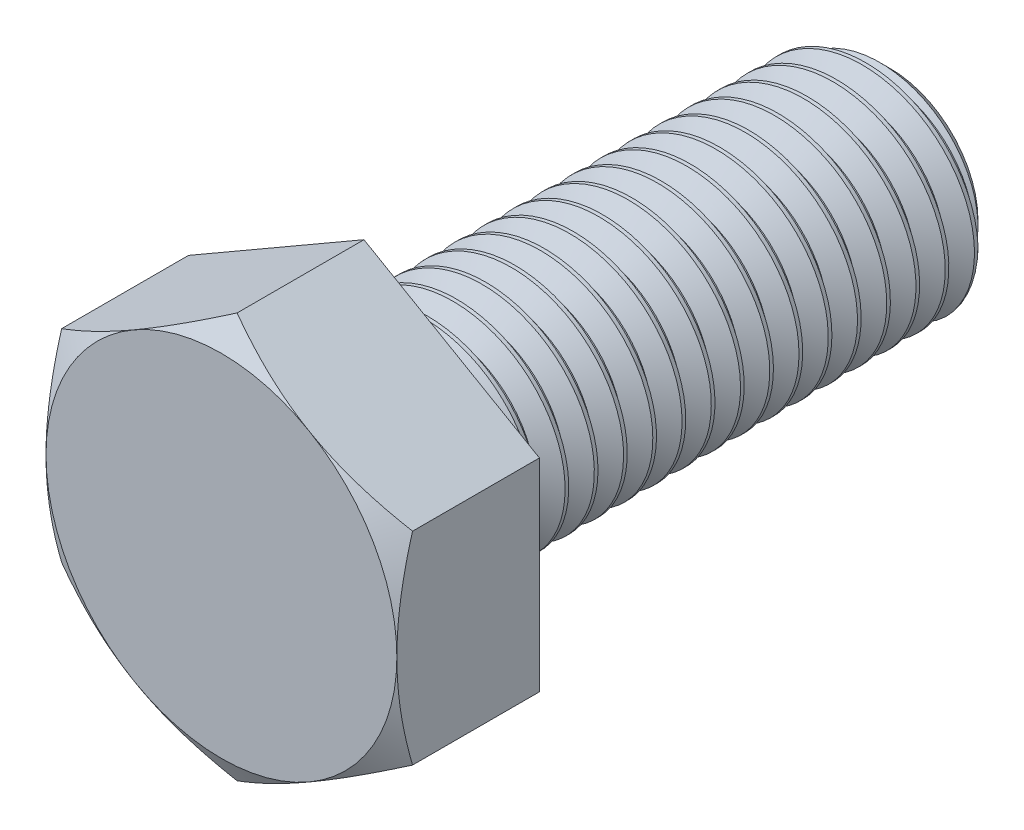
from build123d import *

# Parameters (mm, degrees)
SKETCH2_W           = 19.05
SKETCH2_H           = 3.96875
BOSS_EXTRUDE1_DEPTH = 5.159375
CHAMFER1_SIZE       = 0.79375
SKETCH4_OUTSIDE_W   = 114.714
SKETCH4_OUTSIDE_H   = 116.678
SKETCH4_OUTSIDE_R   = 6.35
CUT_EXTRUDE1_DEPTH  = 27.080254432
CUT_EXTRUDE1_DRAFT  = -60
CUT_SWEEP1_PITCH    = 1.058333333
CUT_SWEEP1_TO       = 19.05


with BuildPart() as part:
    # Sketch2 → Revolve1 (revolve)
    with BuildSketch(Plane(origin=(0, 0, 0), x_dir=(0, 0, -1), z_dir=(1, 0, 0)), mode=Mode.PRIVATE) as revolve1_sk:
        with Locations((9.525, 1.984375)):
            Rectangle(SKETCH2_W, SKETCH2_H)
    revolve(revolve1_sk.sketch.rotate(Axis((0, 0, 0), (0, 0, -1)), 90), axis=Axis((0, 0, 0), (0, 0, -1)))

    # Sketch3 → Boss-Extrude1 (add)
    with BuildSketch(Plane.XY):
        Polygon((0, 7.332348419), (-6.35, 3.666174209), (-6.35, -3.666174209), (0, -7.332348419), (6.35, -3.666174209), (6.35, 3.666174209), align=None)
    extrude(amount=BOSS_EXTRUDE1_DEPTH)

    # Chamfer1
    chamfer1_edges = [part.edges().sort_by_distance(p)[0] for p in [
        (-3.96875, 0, -19.05),
    ]]
    chamfer(chamfer1_edges, length=CHAMFER1_SIZE)


with BuildPart() as cut_extrude1_tool:
    # Sketch4 outside → Cut-Extrude1 (with draft: the straight prism first)
    with BuildSketch(Plane.XY.offset(5.159375)):
        Rectangle(SKETCH4_OUTSIDE_W, SKETCH4_OUTSIDE_H)
        Circle(SKETCH4_OUTSIDE_R, mode=Mode.SUBTRACT)
    extrude(amount=-CUT_EXTRUDE1_DEPTH)
    # Cut-Extrude1: the draft: its side faces are tilted about the plane it starts from
    cut_extrude1_sides = [cut_extrude1_tool.faces().sort_by_distance(p)[0] for p in [
        (0, -58.339, -8.380752216),
        (57.357, 0, -8.380752216),
        (0, 58.339, -8.380752216),
        (-57.357, 0, -8.380752216),
        (-6.35, 0, -8.380752216),
    ]]
    draft(cut_extrude1_sides, Plane.XY.offset(5.159375), CUT_EXTRUDE1_DRAFT)


with BuildPart() as part_1:
    add(part.part)

    # Cut-Extrude1: cut by cut_extrude1_tool
    add(cut_extrude1_tool.part, mode=Mode.SUBTRACT)


with BuildPart() as body_2:
    # Split1: read off the stored shape, not the designer's step
    # Split1: the piece on the far side of the plane
    add(part_1.part)
    split(bisect_by=Plane.XY, keep=Keep.BOTTOM)

    # Cut-Sweep1: arcs per turn and ends read off the stored shape
    # Cut-Sweep1: the profile of Sketch5 screwed along a right-hand helix through 19 turns, 8 arcs to a turn; built about Z, then put on its axis
    cut_sweep1_z = Axis((0, 0, 0), (0, 0, 1))
    cut_sweep1_corners = [(4.026033972, 0, 0.033072917), (4.026033972, 0, -0.959114583), (3.281342336, 0, -0.529166667), (3.281342336, 0, -0.396875)]
    with BuildLine(mode=Mode.PRIVATE) as cut_sweep1_profile:
        Line(cut_sweep1_corners[0], cut_sweep1_corners[1])
        Line(cut_sweep1_corners[1], cut_sweep1_corners[2])
        Line(cut_sweep1_corners[2], cut_sweep1_corners[3])
        Line(cut_sweep1_corners[3], cut_sweep1_corners[0])
    cut_sweep1_cap = Face(cut_sweep1_profile.wire())
    cut_sweep1_turn_angles = [0, 22.5, 45, 67.5, 90, 112.5, 135, 157.5, 180, 202.5, 225, 247.5, 270, 292.5, 315, 337.5, 360]
    cut_sweep1_turn_weights = [1, 0.9238795325112867, 1, 0.9238795325112867, 1, 0.9238795325112867, 1, 0.9238795325112867, 1, 0.9238795325112867, 1, 0.9238795325112867, 1, 0.9238795325112867, 1, 0.9238795325112867, 1]
    cut_sweep1_turn_rails = [Edge.make_bspline([Vector(p[0], p[1], 0).rotate(cut_sweep1_z, cut_sweep1_turn_angles[k]) / cut_sweep1_turn_weights[k] + Vector(0, 0, p[2] + CUT_SWEEP1_PITCH * cut_sweep1_turn_angles[k] / 360) for k in range(17)], [0, 0, 0, 1, 1, 2, 2, 3, 3, 4, 4, 5, 5, 6, 6, 7, 7, 8, 8, 8], 2, cut_sweep1_turn_weights) for p in cut_sweep1_corners]
    cut_sweep1_turn_sides = [Face.make_surface_from_curves(cut_sweep1_turn_rails[p[0]], cut_sweep1_turn_rails[p[1]]) for p in [(0, 1), (1, 2), (2, 3), (3, 0)]]
    cut_sweep1 = Plane(origin=(0, 0, -19.05), x_dir=(0, 1, 0), z_dir=(0, 0, 1)) * split(Solid(Shell([*[p.moved(Location((0, 0, CUT_SWEEP1_PITCH * i))) for i in range(19) for p in cut_sweep1_turn_sides], cut_sweep1_cap, cut_sweep1_cap.rotate(cut_sweep1_z, 6840).moved(Location((0, 0, CUT_SWEEP1_PITCH * 6840 / 360)))])), bisect_by=Plane.XY.offset(CUT_SWEEP1_TO), keep=Keep.BOTTOM, mode=Mode.PRIVATE)
    add(cut_sweep1, mode=Mode.SUBTRACT)


with BuildPart() as part_2:
    add(part_1.part)

    # Split1
    split(bisect_by=Plane.XY, keep=Keep.TOP)

    # Combine1: union body 2
    add(body_2.part)


solid = part_2.part
